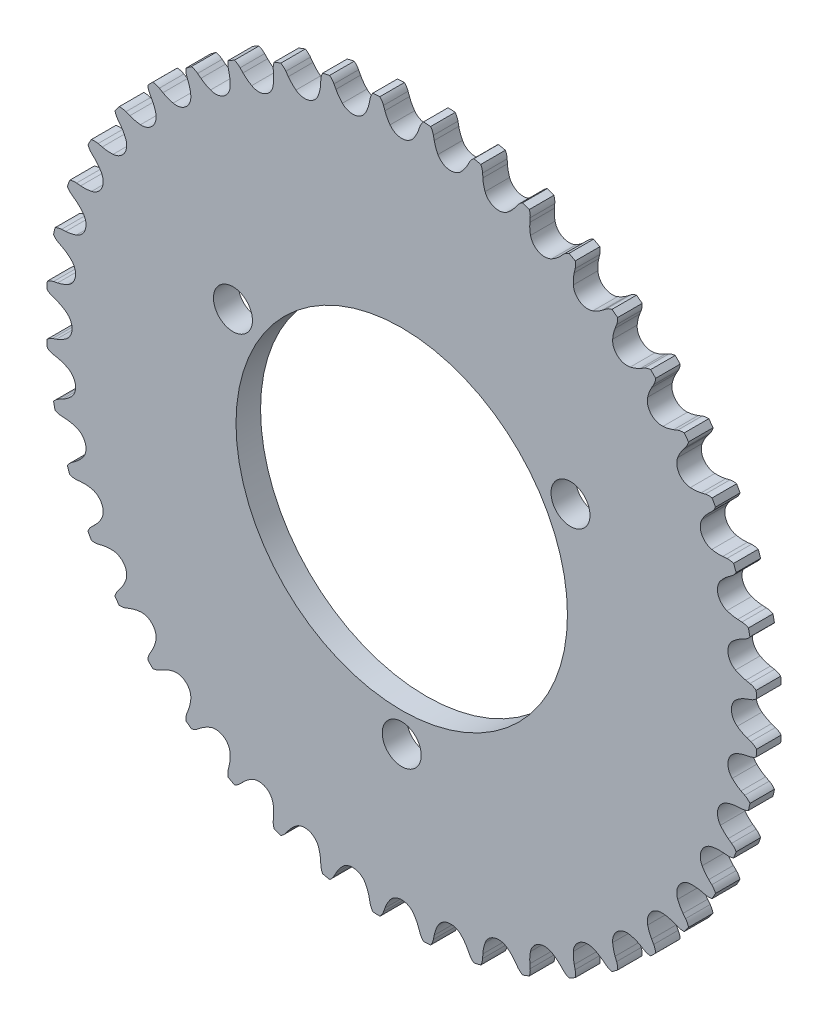
from build123d import *

# Parameters (mm, degrees)
ESQUISSE2_R                  = 53.708418183
BOSS_EXTRU_1_DEPTH           = 4
BOSS_EXTRU_2_START           = -4
BOSS_EXTRU_2_DEPTH           = 4
R_P_TITION_CIRCULAIRE1_COUNT = 44
ESQUISSE4_R                  = 27
ENL_V_MAT_EXTRU_1_DEPTH      = 83.521667369
F_1_4_0_25_DIAMETER_HOLE1_D  = 6.35
ESQUISSE6_R                  = 58.431918183
ESQUISSE6_R_2                = 57.931918183
ENL_V_MAT_EXTRU_3_DEPTH      = 83.521667369


with BuildPart() as part:
    # Esquisse2 → Boss.-Extru.1 (new body)
    with BuildSketch(Plane.XY):
        Circle(ESQUISSE2_R)
    extrude(amount=BOSS_EXTRU_1_DEPTH)

    # Esquisse3 → Boss.-Extru.2 (add)
    with BuildSketch(Plane.XY.offset(4).offset(BOSS_EXTRU_2_START)):
        with BuildLine():
            Line((-5.15876771, 56.727172173), (-5.294061145, 56.059472769))
            ThreePointArc((-5.294061145, 56.059472769), (-5.534703049, 55.199697416), (-5.897844436, 54.384068506))
            ThreePointArc((-5.897844436, 54.384068506), (-6.624972768, 53.564822377), (-7.643504848, 53.161743927))
            ThreePointArc((-7.643504848, 53.161743927), (-3.831514684, 53.571575289), (0, 53.708418183))
            ThreePointArc((0, 53.708418183), (-1.065528936, 53.962441647), (-1.901847031, 54.669867881))
            ThreePointArc((-1.901847031, 54.669867881), (-2.377368258, 55.425514456), (-2.737919565, 56.242291623))
            Line((-2.737919565, 56.242291623), (-2.96685944, 56.883940546))
            ThreePointArc((-2.96685944, 56.883940546), (-3.437882819, 57.694961048), (-4.168485316, 58.283040352))
            ThreePointArc((-4.168485316, 58.283040352), (-4.807958922, 57.596971271), (-5.15876771, 56.727172173))
        make_face()
    boss_extru_2 = extrude(amount=BOSS_EXTRU_2_DEPTH)

    # Répétition circulaire1: Boss.-Extru.2 ×44 about axis
    r_p_tition_circulaire1_axis = Axis((0, 0, 0), (0, 0, 1))
    for i in range(1, R_P_TITION_CIRCULAIRE1_COUNT):
        add(boss_extru_2.rotate(r_p_tition_circulaire1_axis, i * 360 / R_P_TITION_CIRCULAIRE1_COUNT))

    # Esquisse4 → Enlèv. mat.-Extru.1 (cut, through all)
    with BuildSketch(Plane.XY.offset(4)):
        Circle(ESQUISSE4_R)
    extrude(amount=-ENL_V_MAT_EXTRU_1_DEPTH, mode=Mode.SUBTRACT)

    # 1/4 (0.25) Diameter Hole1 (through all)
    with Locations(Plane.XY.offset(4)):
        with Locations((27.49630657, 15.875), (0, -31.75), (-27.49630657, 15.875)):
            Hole(F_1_4_0_25_DIAMETER_HOLE1_D / 2)

    # Esquisse6 → Enlèv. mat.-Extru.3 (cut, through all)
    with BuildSketch(Plane(origin=(0, 0, 0), x_dir=(-1, 0, 0), z_dir=(0, 0, -1))):
        Circle(ESQUISSE6_R)
        Circle(ESQUISSE6_R_2, mode=Mode.SUBTRACT)
    extrude(amount=-ENL_V_MAT_EXTRU_3_DEPTH, mode=Mode.SUBTRACT)


solid = part.part
